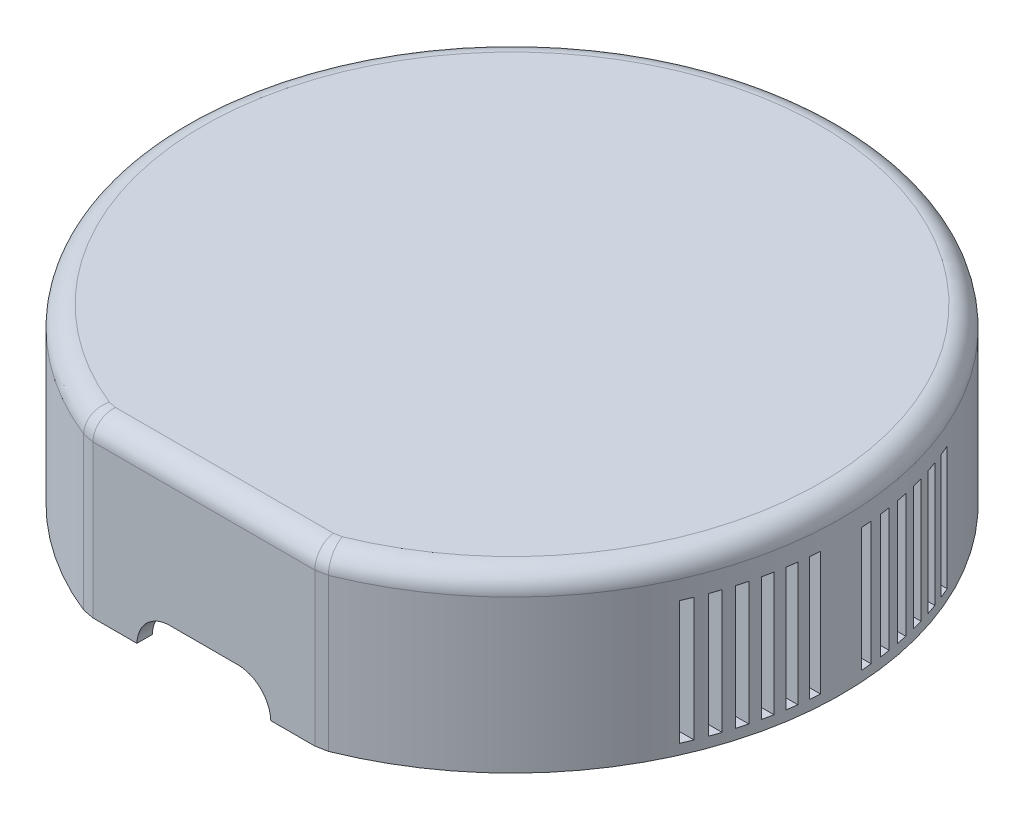
from build123d import *

# Parameters (mm, degrees)
BOSS_EXTRUDE1_DEPTH = 24.8
BOSS_EXTRUDE2_START = -2.4
BOSS_EXTRUDE2_DEPTH = 2.4
BOSS_EXTRUDE3_DEPTH = 3
CUT_EXTRUDE1_DEPTH  = 3
FILLET1_R           = 5.5
FILLET2_R           = 2
SKETCH6_R           = 4
SKETCH6_R_2         = 2.25
BOSS_EXTRUDE4_DEPTH = 1.6
FILLET3_R           = 1
FILLET4_R           = 0.5
CUT_EXTRUDE2_START  = -3
SKETCH7_R           = 2.25
CUT_EXTRUDE2_DEPTH  = 3
FILLET5_R           = 1
CUT_EXTRUDE4_DEPTH  = 8
SKETCH6_3_R         = 4
SKETCH6_3_R_2       = 2.25
BOSS_EXTRUDE5_DEPTH = 19.4
SKETCH9_R           = 4
CUT_EXTRUDE5_DEPTH  = 15.4
FILLET6_R           = 3
CUT_EXTRUDE7_START  = -12
CUT_EXTRUDE7_DEPTH  = 12
CUT_EXTRUDE8_START  = -1.6
CUT_EXTRUDE8_DEPTH  = 1.6
CUT_EXTRUDE9_DEPTH  = 1.5


# Read off the part's stored shape, not the designer's step: Cut-Extrude7, Cut-Extrude8
with BuildPart() as part:
    # Sketch1 → Boss-Extrude1 (new body)
    with BuildSketch(Plane(origin=(0, 0, 0), x_dir=(1, 0, 0), z_dir=(0, 1, 0))):
        with BuildLine():
            ThreePointArc((-11.883644272, -28.785462223), (0, 32.92613482), (11.883644272, -28.785462223))
            Line((11.883644272, -28.785462223), (10.769552622, -29))
            Line((10.769552622, -29), (-10.769552622, -29))
            Line((-10.769552622, -29), (-11.883644272, -28.785462223))
        make_face()
        with BuildLine():
            Line((-10.769552622, -26), (10.769552622, -26))
            ThreePointArc((10.769552622, -26), (0, 29.92613482), (-10.769552622, -26))
        make_face(mode=Mode.SUBTRACT)
    extrude(amount=BOSS_EXTRUDE1_DEPTH)

    # Sketch2 → Boss-Extrude2 (add)
    with BuildSketch(Plane(origin=(0, 24.8, 0), x_dir=(1, 0, 0), z_dir=(0, 1, 0)).offset(BOSS_EXTRUDE2_START)):
        with BuildLine():
            Line((10.769552622, -29), (11.883644272, -28.785462223))
            ThreePointArc((11.883644272, -28.785462223), (0, 32.92613482), (-11.883644272, -28.785462223))
            Line((-11.883644272, -28.785462223), (-10.769552622, -29))
            Line((-10.769552622, -29), (10.769552622, -29))
        make_face()
    extrude(amount=BOSS_EXTRUDE2_DEPTH)

    # Sketch3 → Boss-Extrude3 (add)
    with BuildSketch(Plane.XZ):
        with BuildLine():
            Line((10.769552622, 29), (11.883644272, 28.785462223))
            ThreePointArc((11.883644272, 28.785462223), (0, -32.92613482), (-11.883644272, 28.785462223))
            Line((-11.883644272, 28.785462223), (-10.769552622, 29))
            Line((-10.769552622, 29), (10.769552622, 29))
        make_face()
    extrude(amount=-BOSS_EXTRUDE3_DEPTH)

    # Sketch5 → Cut-Extrude1 (cut)
    with BuildSketch(Plane.XY.offset(29)):
        with BuildLine():
            Line((-3.3, 6.2), (3.3, 6.2))
            ThreePointArc((3.3, 6.2), (5, 7.9), (3.3, 9.6))
            Line((3.3, 9.6), (-3.3, 9.6))
            ThreePointArc((-3.3, 9.6), (-5, 7.9), (-3.3, 6.2))
        make_face()
    extrude(amount=-CUT_EXTRUDE1_DEPTH, mode=Mode.SUBTRACT)

    # Fillet1
    # the kernel refuses this fillet: 5.5 mm, written as the material it takes off along each edge
    with BuildSketch(Plane(origin=(2.732385211, 0, 31.600033606), x_dir=(0.18909335316754428, 0, -0.9819591151304897), z_dir=(-0.9819591151304897, 0, -0.1890933531675443)), Plane(origin=(25.385582105, 0, 26.185428617), x_dir=(-0.1890933531675464, 0, -0.9819591151304894), z_dir=(-0.9819591151304893, 0, 0.18909335316754644))) as fillet1_piece_1:
        with BuildLine():
            CenterArc((FILLET1_R, -FILLET1_R), FILLET1_R, 90, 90)
            Line((0, -FILLET1_R), (0, 0))
            Line((0, 0), (FILLET1_R, 0))
        make_face()
    extrude(amount=28.634560119, mode=Mode.SUBTRACT)
    with BuildSketch(Plane(origin=(0, 0, -0.92613482), x_dir=(-0.0031415874858790054, 0, 0.9999950652018582), z_dir=(0.9999950652018582, 0, 0.0031415874858790054))) as fillet1_piece_2:
        with BuildLine():
            CenterArc((32 - FILLET1_R, -FILLET1_R), FILLET1_R, 0, 90)
            Line((32 - FILLET1_R, 0), (32, 0))
            Line((32, 0), (32, -FILLET1_R))
        make_face()
    revolve(axis=Axis((0, 0, -0.92613482), (0, -1, 0)), revolution_arc=359.64, mode=Mode.SUBTRACT)
    with BuildSketch(Plane(origin=(24.519552622, 0, 29), x_dir=(0, 0, -1), z_dir=(-1, 0, 0))) as fillet1_piece_3:
        with BuildLine():
            CenterArc((FILLET1_R, -FILLET1_R), FILLET1_R, 90, 90)
            Line((0, -FILLET1_R), (0, 0))
            Line((0, 0), (FILLET1_R, 0))
        make_face()
    extrude(amount=49.039105243, mode=Mode.SUBTRACT)

    # Fillet2
    fillet2_edges = [part.edges().sort_by_distance(p)[0] for p in [
        (-11.326598447, 24.8, 28.892731111),
        (0, 24.8, 29),
        (11.326598447, 24.8, 28.892731111),
        (0, 24.8, -32.92613482),
    ]]
    fillet(fillet2_edges, radius=FILLET2_R)

    # Sketch6 → Boss-Extrude4 (add)
    # profile 1 of 3: a face of its own
    with BuildSketch(Plane(origin=(0, 3, 0), x_dir=(1, 0, 0), z_dir=(0, 1, 0))):
        with Locations(Location((-12.821883092, 5.771883092, 0), (0, 0, 90))):
            Circle(SKETCH6_R)
        with Locations(Location((-12.821883092, 5.771883092, 0), (0, 0, 270))):
            Circle(SKETCH6_R_2, mode=Mode.SUBTRACT)
    # profile 2 of 3: a face of its own
    with BuildSketch(Plane(origin=(0, 3, 0), x_dir=(1, 0, 0), z_dir=(0, 1, 0))):
        with Locations(Location((6.27, 5.771883092, 0), (0, 0, 90))):
            Circle(SKETCH6_R)
    # profile 3 of 3: a face of its own
    with BuildSketch(Plane(origin=(0, 3, 0), x_dir=(1, 0, 0), z_dir=(0, 1, 0))):
        with Locations(Location((6.27, -13.32, 0), (0, 0, 90))):
            Circle(SKETCH6_R)
        with Locations(Location((6.27, -13.32, 0), (0, 0, 270))):
            Circle(SKETCH6_R_2, mode=Mode.SUBTRACT)
    extrude(amount=BOSS_EXTRUDE4_DEPTH)

    # Fillet3
    fillet3_edges = [part.edges().sort_by_distance(p)[0] for p in [
        (-12.821883092, 3, -1.771883092),
        (6.27, 3, -1.771883092),
        (6.27, 3, 17.32),
    ]]
    fillet(fillet3_edges, radius=FILLET3_R)

    # Fillet4
    fillet4_edges = [part.edges().sort_by_distance(p)[0] for p in [
        (-12.821883092, 4.6, -1.771883092),
        (6.27, 4.6, -1.771883092),
        (6.27, 4.6, 17.32),
    ]]
    fillet(fillet4_edges, radius=FILLET4_R)

    # Sketch7 → Cut-Extrude2 (cut)
    with BuildSketch(Plane(origin=(0, 3, 0), x_dir=(1, 0, 0), z_dir=(0, 1, 0)).offset(CUT_EXTRUDE2_START)):
        with Locations(Location((6.27, -13.32, 0), (0, 0, 270))):
            Circle(SKETCH7_R)
        with Locations(Location((-12.821883092, 5.771883092, 0), (0, 0, 270))):
            Circle(SKETCH7_R)
    extrude(amount=CUT_EXTRUDE2_DEPTH, mode=Mode.SUBTRACT)

    # Fillet5
    fillet5_edges = [part.edges().sort_by_distance(p)[0] for p in [
        (0, 3, 26),
        (0, 3, -29.92613482),
    ]]
    fillet(fillet5_edges, radius=FILLET5_R)

    # Sketch8 → Cut-Extrude4 (cut)
    with BuildSketch(Plane(origin=(0, 0, 0), x_dir=(1, 0, 0), z_dir=(0, 1, 0))):
        with BuildLine():
            Line((11.883644272, -28.785462223), (10.769552622, -29))
            Line((10.769552622, -29), (-10.769552622, -29))
            Line((-10.769552622, -29), (-11.883644272, -28.785462223))
            ThreePointArc((-11.883644272, -28.785462223), (0, 32.92613482), (11.883644272, -28.785462223))
        make_face()
    extrude(amount=CUT_EXTRUDE4_DEPTH, mode=Mode.SUBTRACT)

    # Sketch6<3> → Boss-Extrude5 (add)
    # profile 1 of 2: a face of its own
    with BuildSketch(Plane(origin=(0, 3, 0), x_dir=(1, 0, 0), z_dir=(0, 1, 0))):
        with Locations(Location((6.27, -13.32, 0), (0, 0, 270))):
            Circle(SKETCH6_3_R)
        with Locations(Location((6.27, -13.32, 0), (0, 0, 270))):
            Circle(SKETCH6_3_R_2, mode=Mode.SUBTRACT)
    # profile 2 of 2: a face of its own
    with BuildSketch(Plane(origin=(0, 3, 0), x_dir=(1, 0, 0), z_dir=(0, 1, 0))):
        with Locations(Location((-12.821883092, 5.771883092, 0), (0, 0, 270))):
            Circle(SKETCH6_3_R)
        with Locations(Location((-12.821883092, 5.771883092, 0), (0, 0, 270))):
            Circle(SKETCH6_3_R_2, mode=Mode.SUBTRACT)
    extrude(amount=BOSS_EXTRUDE5_DEPTH)

    # Sketch9 → Cut-Extrude5 (cut)
    with BuildSketch(Plane.XZ.offset(-3)):
        with Locations(Location((6.27, 13.32, 0), (0, 0, 90))):
            Circle(SKETCH9_R)
        with Locations(Location((-12.821883092, -5.771883092, 0), (0, 0, 90))):
            Circle(SKETCH9_R)
    extrude(amount=-CUT_EXTRUDE5_DEPTH, mode=Mode.SUBTRACT)

    # Fillet6
    fillet6_edges = [part.edges().sort_by_distance(p)[0] for p in [
        (6.27, 22.4, 9.32),
        (-12.821883092, 22.4, -9.771883092),
    ]]
    fillet(fillet6_edges, radius=FILLET6_R)

    # Cut-Extrude7 outline → Cut-Extrude7 (cut)
    with BuildSketch(Plane.XZ.offset(-9).offset(CUT_EXTRUDE7_START)):
        with BuildLine():
            ThreePointArc((-30.049958403, 10.07386518), (-30.227798904, 9.575301911), (-30.397368307, 9.07386518))
            Line((-30.397368307, 9.07386518), (-27.221315178, 9.07386518))
            ThreePointArc((-27.221315178, 9.07386518), (-27.031690052, 9.575661834), (-26.83281573, 10.07386518))
            Line((-26.83281573, 10.07386518), (-30.049958403, 10.07386518))
        make_face()
        with BuildLine():
            Line((-27.568097504, 8.07386518), (-30.708305066, 8.07386518))
            ThreePointArc((-30.708305066, 8.07386518), (-30.85013803, 7.574981787), (-30.98386677, 7.07386518))
            Line((-30.98386677, 7.07386518), (-27.87471973, 7.07386518))
            ThreePointArc((-27.87471973, 7.07386518), (-27.725917401, 7.575247673), (-27.568097504, 8.07386518))
        make_face()
        with BuildLine():
            ThreePointArc((-29.240383035, 12.07386518), (-29.456832295, 11.575666297), (-29.664793949, 11.07386518))
            Line((-29.664793949, 11.07386518), (-26.400757565, 11.07386518))
            ThreePointArc((-26.400757565, 11.07386518), (-26.166637691, 11.57614785), (-25.922962794, 12.07386518))
            Line((-25.922962794, 12.07386518), (-29.240383035, 12.07386518))
        make_face()
        with BuildLine():
            Line((-28.142494559, 6.07386518), (-31.224989992, 6.07386518))
            ThreePointArc((-31.224989992, 6.07386518), (-31.332718336, 5.574692951), (-31.432467291, 5.07386518))
            Line((-31.432467291, 5.07386518), (-28.372521918, 5.07386518))
            ThreePointArc((-28.372521918, 5.07386518), (-28.261931496, 5.57488265), (-28.142494559, 6.07386518))
        make_face()
        with BuildLine():
            Line((-28.565713714, 4.07386518), (-31.606961259, 4.07386518))
            ThreePointArc((-31.606961259, 4.07386518), (-31.681934208, 3.574425686), (-31.749015733, 3.07386518))
            Line((-31.749015733, 3.07386518), (-28.722813233, 3.07386518))
            ThreePointArc((-28.722813233, 3.07386518), (-28.648627017, 3.574550691), (-28.565713714, 4.07386518))
        make_face()
        with BuildLine():
            Line((-28.844410204, 2.07386518), (-31.859064644, 2.07386518))
            ThreePointArc((-31.859064644, 2.07386518), (-31.902170214, 1.574172287), (-31.937438846, 1.07386518))
            Line((-31.937438846, 1.07386518), (-28.930952283, 1.07386518))
            ThreePointArc((-28.930952283, 1.07386518), (-28.892008023, 1.574239629), (-28.844410204, 2.07386518))
        make_face()
        with BuildLine():
            Line((-28.930952283, -2.92613482), (-31.937438846, -2.92613482))
            ThreePointArc((-31.937438846, -2.92613482), (-31.902170214, -3.426441927), (-31.859064644, -3.92613482))
            Line((-31.859064644, -3.92613482), (-28.844410204, -3.92613482))
            ThreePointArc((-28.844410204, -3.92613482), (-28.892008023, -3.426509269), (-28.930952283, -2.92613482))
        make_face()
        with BuildLine():
            Line((-28.722813233, -4.92613482), (-31.749015733, -4.92613482))
            ThreePointArc((-31.749015733, -4.92613482), (-31.681934208, -5.426695326), (-31.606961259, -5.92613482))
            Line((-31.606961259, -5.92613482), (-28.565713714, -5.92613482))
            ThreePointArc((-28.565713714, -5.92613482), (-28.648627017, -5.426820331), (-28.722813233, -4.92613482))
        make_face()
        with BuildLine():
            Line((-28.372521918, -6.92613482), (-31.432467291, -6.92613482))
            ThreePointArc((-31.432467291, -6.92613482), (-31.332718336, -7.426962591), (-31.224989992, -7.92613482))
            Line((-31.224989992, -7.92613482), (-28.142494559, -7.92613482))
            ThreePointArc((-28.142494559, -7.92613482), (-28.261931496, -7.42715229), (-28.372521918, -6.92613482))
        make_face()
        with BuildLine():
            Line((-27.87471973, -8.92613482), (-30.98386677, -8.92613482))
            ThreePointArc((-30.98386677, -8.92613482), (-30.85013803, -9.427251427), (-30.708305066, -9.92613482))
            Line((-30.708305066, -9.92613482), (-27.568097504, -9.92613482))
            ThreePointArc((-27.568097504, -9.92613482), (-27.725917401, -9.427517313), (-27.87471973, -8.92613482))
        make_face()
        with BuildLine():
            Line((-27.221315178, -10.92613482), (-30.397368307, -10.92613482))
            ThreePointArc((-30.397368307, -10.92613482), (-30.227798904, -11.427571551), (-30.049958403, -11.92613482))
            Line((-30.049958403, -11.92613482), (-26.83281573, -11.92613482))
            ThreePointArc((-26.83281573, -11.92613482), (-27.031690052, -11.427931474), (-27.221315178, -10.92613482))
        make_face()
        with BuildLine():
            Line((-26.400757565, -12.92613482), (-29.664793948, -12.92613482))
            ThreePointArc((-29.664793948, -12.92613482), (-29.456832295, -13.427935937), (-29.240383034, -13.92613482))
            Line((-29.240383034, -13.92613482), (-25.922962794, -13.92613482))
            ThreePointArc((-25.922962794, -13.92613482), (-26.166637691, -13.42841749), (-26.400757565, -12.92613482))
        make_face()
        with BuildLine():
            Line((25.922962794, -13.92613482), (29.240383034, -13.92613482))
            ThreePointArc((29.240383034, -13.92613482), (29.456832295, -13.427935937), (29.664793948, -12.92613482))
            Line((29.664793948, -12.92613482), (26.400757565, -12.92613482))
            ThreePointArc((26.400757565, -12.92613482), (26.166637691, -13.42841749), (25.922962794, -13.92613482))
        make_face()
        with BuildLine():
            Line((26.83281573, -11.92613482), (30.049958403, -11.92613482))
            ThreePointArc((30.049958403, -11.92613482), (30.227798904, -11.427571551), (30.397368307, -10.92613482))
            Line((30.397368307, -10.92613482), (27.221315178, -10.92613482))
            ThreePointArc((27.221315178, -10.92613482), (27.031690052, -11.427931474), (26.83281573, -11.92613482))
        make_face()
        with BuildLine():
            Line((27.568097504, -9.92613482), (30.708305066, -9.92613482))
            ThreePointArc((30.708305066, -9.92613482), (30.85013803, -9.427251427), (30.98386677, -8.92613482))
            Line((30.98386677, -8.92613482), (27.87471973, -8.92613482))
            ThreePointArc((27.87471973, -8.92613482), (27.725917401, -9.427517313), (27.568097504, -9.92613482))
        make_face()
        with BuildLine():
            Line((28.142494559, -7.92613482), (31.224989992, -7.92613482))
            ThreePointArc((31.224989992, -7.92613482), (31.332718336, -7.426962591), (31.432467291, -6.92613482))
            Line((31.432467291, -6.92613482), (28.372521918, -6.92613482))
            ThreePointArc((28.372521918, -6.92613482), (28.261931496, -7.42715229), (28.142494559, -7.92613482))
        make_face()
        with BuildLine():
            Line((28.565713714, -5.92613482), (31.606961259, -5.92613482))
            ThreePointArc((31.606961259, -5.92613482), (31.681934208, -5.426695326), (31.749015733, -4.92613482))
            Line((31.749015733, -4.92613482), (28.722813233, -4.92613482))
            ThreePointArc((28.722813233, -4.92613482), (28.648627017, -5.426820331), (28.565713714, -5.92613482))
        make_face()
        with BuildLine():
            Line((28.844410204, -3.92613482), (31.859064644, -3.92613482))
            ThreePointArc((31.859064644, -3.92613482), (31.902170214, -3.426441927), (31.937438846, -2.92613482))
            Line((31.937438846, -2.92613482), (28.930952283, -2.92613482))
            ThreePointArc((28.930952283, -2.92613482), (28.892008023, -3.426509269), (28.844410204, -3.92613482))
        make_face()
        with BuildLine():
            Line((28.930952283, 1.07386518), (31.937438846, 1.07386518))
            ThreePointArc((31.937438846, 1.07386518), (31.902170214, 1.574172287), (31.859064644, 2.07386518))
            Line((31.859064644, 2.07386518), (28.844410204, 2.07386518))
            ThreePointArc((28.844410204, 2.07386518), (28.892008023, 1.574239629), (28.930952283, 1.07386518))
        make_face()
        with BuildLine():
            Line((28.722813233, 3.07386518), (31.749015733, 3.07386518))
            ThreePointArc((31.749015733, 3.07386518), (31.681934208, 3.574425686), (31.606961259, 4.07386518))
            Line((31.606961259, 4.07386518), (28.565713714, 4.07386518))
            ThreePointArc((28.565713714, 4.07386518), (28.648627017, 3.574550691), (28.722813233, 3.07386518))
        make_face()
        with BuildLine():
            Line((28.372521918, 5.07386518), (31.432467291, 5.07386518))
            ThreePointArc((31.432467291, 5.07386518), (31.332718336, 5.574692951), (31.224989992, 6.07386518))
            Line((31.224989992, 6.07386518), (28.142494559, 6.07386518))
            ThreePointArc((28.142494559, 6.07386518), (28.261931496, 5.57488265), (28.372521918, 5.07386518))
        make_face()
        with BuildLine():
            Line((27.87471973, 7.07386518), (30.98386677, 7.07386518))
            ThreePointArc((30.98386677, 7.07386518), (30.85013803, 7.574981787), (30.708305066, 8.07386518))
            Line((30.708305066, 8.07386518), (27.568097504, 8.07386518))
            ThreePointArc((27.568097504, 8.07386518), (27.725917401, 7.575247673), (27.87471973, 7.07386518))
        make_face()
        with BuildLine():
            Line((27.221315178, 9.07386518), (30.397368307, 9.07386518))
            ThreePointArc((30.397368307, 9.07386518), (30.227798904, 9.575301911), (30.049958403, 10.07386518))
            Line((30.049958403, 10.07386518), (26.83281573, 10.07386518))
            ThreePointArc((26.83281573, 10.07386518), (27.031690052, 9.575661834), (27.221315178, 9.07386518))
        make_face()
        with BuildLine():
            Line((26.400757565, 11.07386518), (29.664793949, 11.07386518))
            ThreePointArc((29.664793949, 11.07386518), (29.456832295, 11.575666297), (29.240383035, 12.07386518))
            Line((29.240383035, 12.07386518), (25.922962794, 12.07386518))
            ThreePointArc((25.922962794, 12.07386518), (26.166637691, 11.57614785), (26.400757565, 11.07386518))
        make_face()
    extrude(amount=CUT_EXTRUDE7_DEPTH, mode=Mode.SUBTRACT)

    # Cut-Extrude8 outline → Cut-Extrude8 (cut)
    with BuildSketch(Plane.XZ.offset(-8).offset(CUT_EXTRUDE8_START)):
        with BuildLine():
            Line((-10.626441683, 27.5), (-11.457772831, 27.339912689))
            ThreePointArc((-11.457772831, 27.339912689), (0, -31.42613482), (11.457772831, 27.339912689))
            Line((11.457772831, 27.339912689), (10.626441683, 27.5))
            Line((10.626441683, 27.5), (-10.626441683, 27.5))
        make_face()
        with BuildLine():
            Line((-10.769552622, 26), (10.769552622, 26))
            ThreePointArc((10.769552622, 26), (0, -29.92613482), (-10.769552622, 26))
        make_face(mode=Mode.SUBTRACT)
    extrude(amount=CUT_EXTRUDE8_DEPTH, mode=Mode.SUBTRACT)

    # Sketch5<6> → Cut-Extrude9 (cut)
    with BuildSketch(Plane.XY.offset(29)):
        with BuildLine():
            Line((-3.3, 11.1), (3.3, 11.1))
            ThreePointArc((3.3, 11.1), (6.5, 7.9), (3.3, 4.7))
            Line((3.3, 4.7), (-3.3, 4.7))
            ThreePointArc((-3.3, 4.7), (-6.5, 7.9), (-3.3, 11.1))
        make_face()
        with BuildLine():
            ThreePointArc((3.3, 6.2), (5, 7.9), (3.3, 9.6))
            Line((3.3, 9.6), (-3.3, 9.6))
            ThreePointArc((-3.3, 9.6), (-5, 7.9), (-3.3, 6.2))
            Line((-3.3, 6.2), (3.3, 6.2))
        make_face(mode=Mode.SUBTRACT)
    extrude(amount=-CUT_EXTRUDE9_DEPTH, mode=Mode.SUBTRACT)


solid = part.part
